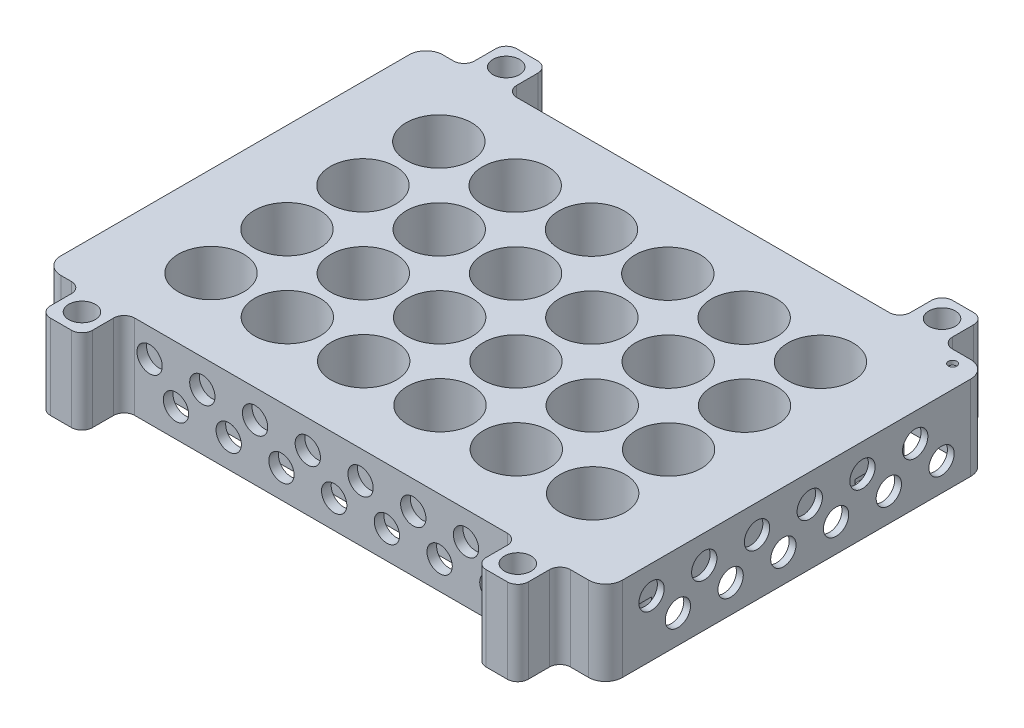
from build123d import *

# Parameters (mm, degrees)
SKETCH1_W           = 157.864
SKETCH1_H           = 90.551
BOSS_EXTRUDE1_DEPTH = 24.5
CUT_EXTRUDE30_DEPTH = 24.5
CUT_EXTRUDE5_START  = -24.5
SKETCH7_R           = 7.75
CUT_EXTRUDE5_DEPTH  = 17
SKETCH23_W          = 129.2861173
SKETCH23_H          = 86.72376579
SKETCH23_W_2        = 111.4861173
SKETCH23_H_2        = 74.72376579
CUT_EXTRUDE21_DEPTH = 4.5
FILLET7_R           = 1
FILLET8_R           = 2.75
SKETCH26_W          = 116.5861173
SKETCH26_H          = 74.72376579
CUT_EXTRUDE22_DEPTH = 3
SKETCH29_W          = 12.37533
SKETCH29_H          = 90.551
CUT_EXTRUDE25_DEPTH = 184.632176094
FILLET9_R           = 4
SKETCH30_W          = 10
SKETCH30_H          = 10
BOSS_EXTRUDE2_DEPTH = 24.5
SKETCH31_R          = 3.15
CUT_EXTRUDE26_DEPTH = 179.543290827
FILLET10_R          = 2.5
SKETCH35_R          = 1.4
BOSS_EXTRUDE3_DEPTH = 0.75
SKETCH37_W          = 236.034585018
SKETCH37_H          = 147.923412956
CUT_EXTRUDE29_DEPTH = 4.5
SKETCH36_W          = 129.28401949
SKETCH36_H          = 86.172693175
SKETCH36_W_2        = 111.787906872
SKETCH36_H_2        = 76.072830146
CUT_EXTRUDE28_DEPTH = 17
FILLET11_R          = 4
FILLET12_R          = 4
SKETCH42_R          = 3.1
CUT_EXTRUDE31_DEPTH = 2.75
SKETCH43_R          = 1
CUT_EXTRUDE32_DEPTH = 1
SKETCH44_R          = 3
CUT_EXTRUDE33_DEPTH = 2.220919758
SKETCH45_R          = 3
CUT_EXTRUDE34_DEPTH = 2.286228198
CUT_EXTRUDE35_START = -1.608400752
SKETCH46_R          = 3
CUT_EXTRUDE35_DEPTH = 1.608400752
SKETCH47_R          = 3
CUT_EXTRUDE36_DEPTH = 2.092078627


with BuildPart() as part:
    # Sketch1 → Boss-Extrude1 (new body)
    with BuildSketch(Plane(origin=(0, 0, 0), x_dir=(1, 0, 0), z_dir=(0, 1, 0))):
        with Locations((78.932, -45.2755)):
            Rectangle(SKETCH1_W, SKETCH1_H)
    extrude(amount=BOSS_EXTRUDE1_DEPTH)

    # Sketch39 → Cut-Extrude30 (cut)
    with BuildSketch(Plane(origin=(0, 24.5, 0), x_dir=(1, 0, 0), z_dir=(0, 1, 0))):
        Polygon((37.005804, -18.5555), (30.948984, -18.5555), (30.408196, -19.088448), (30.408196, -25.18537), (37.005804, -25.18537), align=None)
        Polygon((55.095804, -11.36563), (49.038984, -11.36563), (48.498196, -11.898578), (48.498196, -17.9955), (55.095804, -17.9955), align=None)
        Polygon((73.185804, -11.36563), (67.128984, -11.36563), (66.588196, -11.898578), (66.588196, -17.9955), (73.185804, -17.9955), align=None)
        Polygon((91.275804, -11.36563), (85.218984, -11.36563), (84.678196, -11.898578), (84.678196, -17.9955), (91.275804, -17.9955), align=None)
        Polygon((109.365804, -11.36563), (103.308984, -11.36563), (102.768196, -11.898578), (102.768196, -17.9955), (109.365804, -17.9955), align=None)
        Polygon((127.455804, -11.36563), (121.398984, -11.36563), (120.858196, -11.898578), (120.858196, -17.9955), (127.455804, -17.9955), align=None)
        Polygon((55.095804, -29.36563), (49.038984, -29.36563), (48.498196, -29.898578), (48.498196, -35.9955), (55.095804, -35.9955), align=None)
        Polygon((73.185804, -29.36563), (67.128984, -29.36563), (66.588196, -29.898578), (66.588196, -35.9955), (73.185804, -35.9955), align=None)
        Polygon((91.275804, -29.36563), (85.218984, -29.36563), (84.678196, -29.898578), (84.678196, -35.9955), (91.275804, -35.9955), align=None)
        Polygon((109.365804, -29.36563), (103.308984, -29.36563), (102.768196, -29.898578), (102.768196, -35.9955), (109.365804, -35.9955), align=None)
        Polygon((127.455804, -29.36563), (121.398984, -29.36563), (120.858196, -29.898578), (120.858196, -35.9955), (127.455804, -35.9955), align=None)
        Polygon((55.095804, -47.36563), (49.038984, -47.36563), (48.498196, -47.898578), (48.498196, -53.9955), (55.095804, -53.9955), align=None)
        Polygon((73.185804, -47.36563), (67.128984, -47.36563), (66.588196, -47.898578), (66.588196, -53.9955), (73.185804, -53.9955), align=None)
        Polygon((91.275804, -47.36563), (85.218984, -47.36563), (84.678196, -47.898578), (84.678196, -53.9955), (91.275804, -53.9955), align=None)
        Polygon((109.365804, -47.36563), (103.308984, -47.36563), (102.768196, -47.898578), (102.768196, -53.9955), (109.365804, -53.9955), align=None)
        Polygon((127.455804, -47.36563), (121.398984, -47.36563), (120.858196, -47.898578), (120.858196, -53.9955), (127.455804, -53.9955), align=None)
        Polygon((55.095804, -65.36563), (49.038984, -65.36563), (48.498196, -65.898578), (48.498196, -71.9955), (55.095804, -71.9955), align=None)
        Polygon((73.185804, -65.36563), (67.128984, -65.36563), (66.588196, -65.898578), (66.588196, -71.9955), (73.185804, -71.9955), align=None)
        Polygon((91.275804, -65.36563), (85.218984, -65.36563), (84.678196, -65.898578), (84.678196, -71.9955), (91.275804, -71.9955), align=None)
        Polygon((109.365804, -65.36563), (103.308984, -65.36563), (102.768196, -65.898578), (102.768196, -71.9955), (109.365804, -71.9955), align=None)
        Polygon((127.455804, -65.36563), (121.398984, -65.36563), (120.858196, -65.898578), (120.858196, -71.9955), (127.455804, -71.9955), align=None)
        Polygon((37.005804, -29.36563), (30.948984, -29.36563), (30.408196, -29.898578), (30.408196, -35.9955), (37.005804, -35.9955), align=None)
        Polygon((37.005804, -47.36563), (30.948984, -47.36563), (30.408196, -47.898578), (30.408196, -53.9955), (37.005804, -53.9955), align=None)
        Polygon((37.005804, -65.36563), (30.948984, -65.36563), (30.408196, -65.898578), (30.408196, -71.9955), (37.005804, -71.9955), align=None)
        Polygon((37.005804, -11.36563), (30.948984, -11.36563), (30.408196, -11.898578), (30.408196, -17.9955), (37.005804, -17.9955), align=None)
        Polygon((48.498196, -25.18537), (55.095804, -25.18537), (55.095804, -18.5555), (49.038984, -18.5555), (48.498196, -19.088448), align=None)
        Polygon((66.588196, -25.18537), (73.185804, -25.18537), (73.185804, -18.5555), (67.128984, -18.5555), (66.588196, -19.088448), align=None)
        Polygon((84.678196, -25.18537), (91.275804, -25.18537), (91.275804, -18.5555), (85.218984, -18.5555), (84.678196, -19.088448), align=None)
        Polygon((102.768196, -25.18537), (109.365804, -25.18537), (109.365804, -18.5555), (103.308984, -18.5555), (102.768196, -19.088448), align=None)
        Polygon((120.858196, -25.18537), (127.455804, -25.18537), (127.455804, -18.5555), (121.398984, -18.5555), (120.858196, -19.088448), align=None)
        Polygon((48.498196, -43.18537), (55.095804, -43.18537), (55.095804, -36.5555), (49.038984, -36.5555), (48.498196, -37.088448), align=None)
        Polygon((66.588196, -43.18537), (73.185804, -43.18537), (73.185804, -36.5555), (67.128984, -36.5555), (66.588196, -37.088448), align=None)
        Polygon((84.678196, -43.18537), (91.275804, -43.18537), (91.275804, -36.5555), (85.218984, -36.5555), (84.678196, -37.088448), align=None)
        Polygon((102.768196, -43.18537), (109.365804, -43.18537), (109.365804, -36.5555), (103.308984, -36.5555), (102.768196, -37.088448), align=None)
        Polygon((120.858196, -43.18537), (127.455804, -43.18537), (127.455804, -36.5555), (121.398984, -36.5555), (120.858196, -37.088448), align=None)
        Polygon((48.498196, -61.18537), (55.095804, -61.18537), (55.095804, -54.5555), (49.038984, -54.5555), (48.498196, -55.088448), align=None)
        Polygon((66.588196, -61.18537), (73.185804, -61.18537), (73.185804, -54.5555), (67.128984, -54.5555), (66.588196, -55.088448), align=None)
        Polygon((84.678196, -61.18537), (91.275804, -61.18537), (91.275804, -54.5555), (85.218984, -54.5555), (84.678196, -55.088448), align=None)
        Polygon((102.768196, -61.18537), (109.365804, -61.18537), (109.365804, -54.5555), (103.308984, -54.5555), (102.768196, -55.088448), align=None)
        Polygon((120.858196, -61.18537), (127.455804, -61.18537), (127.455804, -54.5555), (121.398984, -54.5555), (120.858196, -55.088448), align=None)
        Polygon((48.498196, -79.18537), (55.095804, -79.18537), (55.095804, -72.5555), (49.038984, -72.5555), (48.498196, -73.088448), align=None)
        Polygon((66.588196, -79.18537), (73.185804, -79.18537), (73.185804, -72.5555), (67.128984, -72.5555), (66.588196, -73.088448), align=None)
        Polygon((84.678196, -79.18537), (91.275804, -79.18537), (91.275804, -72.5555), (85.218984, -72.5555), (84.678196, -73.088448), align=None)
        Polygon((102.768196, -79.18537), (109.365804, -79.18537), (109.365804, -72.5555), (103.308984, -72.5555), (102.768196, -73.088448), align=None)
        Polygon((120.858196, -79.18537), (127.455804, -79.18537), (127.455804, -72.5555), (121.398984, -72.5555), (120.858196, -73.088448), align=None)
        Polygon((30.408196, -43.18537), (37.005804, -43.18537), (37.005804, -36.5555), (30.948984, -36.5555), (30.408196, -37.088448), align=None)
        Polygon((30.408196, -61.18537), (37.005804, -61.18537), (37.005804, -54.5555), (30.948984, -54.5555), (30.408196, -55.088448), align=None)
        Polygon((30.408196, -79.18537), (37.005804, -79.18537), (37.005804, -72.5555), (30.948984, -72.5555), (30.408196, -73.088448), align=None)
    extrude(amount=-CUT_EXTRUDE30_DEPTH, mode=Mode.SUBTRACT)

    # Sketch7 → Cut-Extrude5 (cut)
    with BuildSketch(Plane.XZ.offset(CUT_EXTRUDE5_START)):
        with Locations(Location((33.707, 72.2755, 0), (0, 0, 90))):
            Circle(SKETCH7_R)
        with Locations(Location((51.797, 72.2755, 0), (0, 0, 90))):
            Circle(SKETCH7_R)
        with Locations(Location((69.887, 72.2755, 0), (0, 0, 90))):
            Circle(SKETCH7_R)
        with Locations(Location((87.977, 72.2755, 0), (0, 0, 90))):
            Circle(SKETCH7_R)
        with Locations(Location((106.067, 72.2755, 0), (0, 0, 90))):
            Circle(SKETCH7_R)
        with Locations(Location((124.157, 72.2755, 0), (0, 0, 90))):
            Circle(SKETCH7_R)
        with Locations(Location((51.797, 54.2755, 0), (0, 0, 90))):
            Circle(SKETCH7_R)
        with Locations(Location((69.887, 54.2755, 0), (0, 0, 90))):
            Circle(SKETCH7_R)
        with Locations(Location((87.977, 54.2755, 0), (0, 0, 90))):
            Circle(SKETCH7_R)
        with Locations(Location((106.067, 54.2755, 0), (0, 0, 90))):
            Circle(SKETCH7_R)
        with Locations(Location((124.157, 54.2755, 0), (0, 0, 90))):
            Circle(SKETCH7_R)
        with Locations(Location((51.797, 36.2755, 0), (0, 0, 90))):
            Circle(SKETCH7_R)
        with Locations(Location((69.887, 36.2755, 0), (0, 0, 90))):
            Circle(SKETCH7_R)
        with Locations(Location((87.977, 36.2755, 0), (0, 0, 90))):
            Circle(SKETCH7_R)
        with Locations(Location((106.067, 36.2755, 0), (0, 0, 90))):
            Circle(SKETCH7_R)
        with Locations(Location((124.157, 36.2755, 0), (0, 0, 90))):
            Circle(SKETCH7_R)
        with Locations(Location((51.797, 18.2755, 0), (0, 0, 90))):
            Circle(SKETCH7_R)
        with Locations(Location((69.887, 18.2755, 0), (0, 0, 90))):
            Circle(SKETCH7_R)
        with Locations(Location((87.977, 18.2755, 0), (0, 0, 90))):
            Circle(SKETCH7_R)
        with Locations(Location((106.067, 18.2755, 0), (0, 0, 90))):
            Circle(SKETCH7_R)
        with Locations(Location((124.157, 18.2755, 0), (0, 0, 90))):
            Circle(SKETCH7_R)
        with Locations(Location((33.707, 54.2755, 0), (0, 0, 90))):
            Circle(SKETCH7_R)
        with Locations(Location((33.707, 36.2755, 0), (0, 0, 90))):
            Circle(SKETCH7_R)
        with Locations(Location((33.707, 18.2755, 0), (0, 0, 90))):
            Circle(SKETCH7_R)
    extrude(amount=CUT_EXTRUDE5_DEPTH, mode=Mode.SUBTRACT)

    # Sketch23 → Cut-Extrude21 (cut)
    with BuildSketch(Plane(origin=(0, 24.5, 0), x_dir=(1, 0, 0), z_dir=(0, 1, 0))):
        with Locations((78.93200135, -45.275497105)):
            Rectangle(SKETCH23_W, SKETCH23_H)
        with Locations((78.93200135, -45.275497105)):
            Rectangle(SKETCH23_W_2, SKETCH23_H_2, mode=Mode.SUBTRACT)
    extrude(amount=-CUT_EXTRUDE21_DEPTH, mode=Mode.SUBTRACT)

    # Fillet7
    fillet7_edges = [part.edges().sort_by_distance(p)[0] for p in [
        (134.67506, 22.25, 82.63738),
        (23.1889427, 22.25, 82.63738),
        (23.1889427, 22.25, 7.91361421),
        (134.67506, 22.25, 7.91361421),
    ]]
    fillet(fillet7_edges, radius=FILLET7_R)

    # Fillet8
    fillet8_edges = [part.edges().sort_by_distance(p)[0] for p in [
        (143.57506, 22.25, 1.91361421),
        (143.57506, 22.25, 88.63738),
        (14.2889427, 22.25, 88.63738),
        (14.2889427, 22.25, 1.91361421),
    ]]
    fillet(fillet8_edges, radius=FILLET8_R)

    # Sketch26 → Cut-Extrude22 (cut)
    with BuildSketch(Plane(origin=(0, 24.5, 0), x_dir=(1, 0, 0), z_dir=(0, 1, 0))):
        with Locations((76.38200135, -45.275497105)):
            Rectangle(SKETCH26_W, SKETCH26_H)
    extrude(amount=-CUT_EXTRUDE22_DEPTH, mode=Mode.SUBTRACT)

    # Sketch29 → Cut-Extrude25 (cut, through all)
    with BuildSketch(Plane(origin=(0, 24.5, 0), x_dir=(1, 0, 0), z_dir=(0, 1, 0))):
        with Locations((151.676335, -45.2755)):
            Rectangle(SKETCH29_W, SKETCH29_H)
        with Locations((6.187665, -45.2755)):
            Rectangle(SKETCH29_W, SKETCH29_H)
    extrude(amount=-CUT_EXTRUDE25_DEPTH, mode=Mode.SUBTRACT)

    # Fillet9
    fillet9_edges = [part.edges().sort_by_distance(p)[0] for p in [
        (145.48867, 12.25, 90.551),
        (145.48867, 12.25, 0),
        (12.37533, 12.25, 0),
        (12.37533, 12.25, 90.551),
    ]]
    fillet(fillet9_edges, radius=FILLET9_R)

    # Sketch30 → Boss-Extrude2 (add, through all)
    with BuildSketch(Plane.XZ):
        with Locations((129.6936, -5)):
            Rectangle(SKETCH30_W, SKETCH30_H)
        with Locations((26.3936, -5)):
            Rectangle(SKETCH30_W, SKETCH30_H)
        with Locations((129.6936, 95.551)):
            Rectangle(SKETCH30_W, SKETCH30_H)
        with Locations((26.3936, 95.551)):
            Rectangle(SKETCH30_W, SKETCH30_H)
    extrude(amount=-BOSS_EXTRUDE2_DEPTH)

    # Sketch31 → Cut-Extrude26 (cut, through all)
    with BuildSketch(Plane(origin=(0, 24.5, 0), x_dir=(1, 0, 0), z_dir=(0, 1, 0))):
        with Locations(Location((26.3936, 5, 0), (0, 0, 270))):
            Circle(SKETCH31_R)
        with Locations(Location((129.6936, 5, 0), (0, 0, 270))):
            Circle(SKETCH31_R)
        with Locations(Location((26.3936, -95.551, 0), (0, 0, 270))):
            Circle(SKETCH31_R)
        with Locations(Location((129.6936, -95.551, 0), (0, 0, 270))):
            Circle(SKETCH31_R)
    extrude(amount=-CUT_EXTRUDE26_DEPTH, mode=Mode.SUBTRACT)

    # Fillet10
    fillet10_edges = [part.edges().sort_by_distance(p)[0] for p in [
        (134.6936, 12.25, 0),
        (134.6936, 12.25, -10),
        (124.6936, 12.25, -10),
        (124.6936, 12.25, 0),
        (21.3936, 12.25, -10),
        (21.3936, 12.25, 0),
        (31.3936, 12.25, 0),
        (31.3936, 12.25, -10),
        (134.6936, 12.25, 100.551),
        (134.6936, 12.25, 90.551),
        (124.6936, 12.25, 90.551),
        (124.6936, 12.25, 100.551),
        (21.3936, 12.25, 90.551),
        (21.3936, 12.25, 100.551),
        (31.3936, 12.25, 100.551),
        (31.3936, 12.25, 90.551),
    ]]
    fillet(fillet10_edges, radius=FILLET10_R)

    # Sketch35 → Boss-Extrude3 (add)
    with BuildSketch(Plane(origin=(0, 21.5, 0), x_dir=(1, 0, 0), z_dir=(0, 1, 0))):
        with Locations(Location((115.112, -27.2755, 0), (0, 0, 90))):
            Circle(SKETCH35_R)
        with Locations(Location((42.752, -63.2755, 0), (0, 0, 90))):
            Circle(SKETCH35_R)
    extrude(amount=BOSS_EXTRUDE3_DEPTH)

    # Sketch37 → Cut-Extrude29 (cut)
    with BuildSketch(Plane(origin=(0, 24.5, 0), x_dir=(1, 0, 0), z_dir=(0, 1, 0))):
        with Locations((96.643531952, -44.613547987)):
            Rectangle(SKETCH37_W, SKETCH37_H)
    extrude(amount=-CUT_EXTRUDE29_DEPTH, mode=Mode.SUBTRACT)

    # Sketch36 → Cut-Extrude28 (cut)
    with BuildSketch(Plane.XZ):
        with Locations((79.238259503, 45.178425215)):
            Rectangle(SKETCH36_W, SKETCH36_H)
        with Locations((79.238259503, 45.178425215)):
            Rectangle(SKETCH36_W_2, SKETCH36_H_2, mode=Mode.SUBTRACT)
    extrude(amount=-CUT_EXTRUDE28_DEPTH, mode=Mode.SUBTRACT)

    # Fillet11
    fillet11_edges = [part.edges().sort_by_distance(p)[0] for p in [
        (23.344306067, 8.5, 83.214840288),
        (135.132212939, 8.5, 83.214840288),
        (135.132212939, 8.5, 7.142010142),
        (23.344306067, 8.5, 7.142010142),
    ]]
    fillet(fillet11_edges, radius=FILLET11_R)

    # Fillet12
    fillet12_edges = [part.edges().sort_by_distance(p)[0] for p in [
        (14.596249758, 8.5, 2.092078627),
        (14.596249758, 8.5, 88.264771802),
        (143.880269248, 8.5, 88.264771802),
        (143.880269248, 8.5, 2.092078627),
    ]]
    fillet(fillet12_edges, radius=FILLET12_R)

    # Sketch42 → Cut-Extrude31 (cut)
    with BuildSketch(Plane.XZ):
        with Locations((22.183259503, 72.173425215)):
            Circle(SKETCH42_R)
        with Locations((22.183259503, 18.183425215)):
            Circle(SKETCH42_R)
        with Locations((136.293259503, 18.183425215)):
            Circle(SKETCH42_R)
        with Locations((136.293259503, 72.173425215)):
            Circle(SKETCH42_R)
    extrude(amount=-CUT_EXTRUDE31_DEPTH, mode=Mode.SUBTRACT)

    # Sketch43 → Cut-Extrude32 (cut)
    with BuildSketch(Plane(origin=(0, 20, 0), x_dir=(1, 0, 0), z_dir=(0, 1, 0))):
        with Locations(Location((140.1936, -3, 0), (0, 0, 270))):
            Circle(SKETCH43_R)
    extrude(amount=-CUT_EXTRUDE32_DEPTH, mode=Mode.SUBTRACT)

    # Sketch44 → Cut-Extrude33 (cut)
    with BuildSketch(Plane.ZY.offset(-12.37533)):
        with Locations((10.9005, 6.666666667)):
            Circle(SKETCH44_R)
        with Locations((23.4005, 6.666666667)):
            Circle(SKETCH44_R)
        with Locations((35.9005, 6.666666667)):
            Circle(SKETCH44_R)
        with Locations((48.4005, 6.666666667)):
            Circle(SKETCH44_R)
        with Locations((60.9005, 6.666666667)):
            Circle(SKETCH44_R)
        with Locations((73.4005, 6.666666667)):
            Circle(SKETCH44_R)
        with Locations((17.1505, 13.333333333)):
            Circle(SKETCH44_R)
        with Locations((29.6505, 13.333333333)):
            Circle(SKETCH44_R)
        with Locations((42.1505, 13.333333333)):
            Circle(SKETCH44_R)
        with Locations((54.6505, 13.333333333)):
            Circle(SKETCH44_R)
        with Locations((67.1505, 13.333333333)):
            Circle(SKETCH44_R)
        with Locations((79.6505, 13.333333333)):
            Circle(SKETCH44_R)
    extrude(amount=-CUT_EXTRUDE33_DEPTH, mode=Mode.SUBTRACT)

    # Sketch45 → Cut-Extrude34 (cut)
    with BuildSketch(Plane.XY.offset(90.551)):
        with Locations((37.4186, 13.333333333)):
            Circle(SKETCH45_R)
        with Locations((49.9186, 13.333333333)):
            Circle(SKETCH45_R)
        with Locations((62.4186, 13.333333333)):
            Circle(SKETCH45_R)
        with Locations((74.9186, 13.333333333)):
            Circle(SKETCH45_R)
        with Locations((87.4186, 13.333333333)):
            Circle(SKETCH45_R)
        with Locations((99.9186, 13.333333333)):
            Circle(SKETCH45_R)
        with Locations((112.4186, 13.333333333)):
            Circle(SKETCH45_R)
        with Locations((43.6686, 6.666666667)):
            Circle(SKETCH45_R)
        with Locations((56.1686, 6.666666667)):
            Circle(SKETCH45_R)
        with Locations((68.6686, 6.666666667)):
            Circle(SKETCH45_R)
        with Locations((81.1686, 6.666666667)):
            Circle(SKETCH45_R)
        with Locations((93.6686, 6.666666667)):
            Circle(SKETCH45_R)
        with Locations((106.1686, 6.666666667)):
            Circle(SKETCH45_R)
        with Locations((118.6686, 6.666666667)):
            Circle(SKETCH45_R)
    extrude(amount=-CUT_EXTRUDE34_DEPTH, mode=Mode.SUBTRACT)

    # Sketch46 → Cut-Extrude35 (cut)
    with BuildSketch(Plane(origin=(145.48867, 0, 0), x_dir=(0, 0, -1), z_dir=(1, 0, 0)).offset(CUT_EXTRUDE35_START)):
        with Locations(Location((-79.6505, 13.333333333, 0), (0, 0, 180))):
            Circle(SKETCH46_R)
        with Locations(Location((-67.1505, 13.333333333, 0), (0, 0, 180))):
            Circle(SKETCH46_R)
        with Locations(Location((-54.6505, 13.333333333, 0), (0, 0, 180))):
            Circle(SKETCH46_R)
        with Locations(Location((-42.1505, 13.333333333, 0), (0, 0, 180))):
            Circle(SKETCH46_R)
        with Locations(Location((-29.6505, 13.333333333, 0), (0, 0, 180))):
            Circle(SKETCH46_R)
        with Locations(Location((-73.4005, 6.666666667, 0), (0, 0, 180))):
            Circle(SKETCH46_R)
        with Locations(Location((-17.1505, 13.333333333, 0), (0, 0, 180))):
            Circle(SKETCH46_R)
        with Locations(Location((-60.9005, 6.666666667, 0), (0, 0, 180))):
            Circle(SKETCH46_R)
        with Locations(Location((-48.4005, 6.666666667, 0), (0, 0, 180))):
            Circle(SKETCH46_R)
        with Locations(Location((-35.9005, 6.666666667, 0), (0, 0, 180))):
            Circle(SKETCH46_R)
        with Locations(Location((-23.4005, 6.666666667, 0), (0, 0, 180))):
            Circle(SKETCH46_R)
        with Locations(Location((-10.9005, 6.666666667, 0), (0, 0, 180))):
            Circle(SKETCH46_R)
    extrude(amount=CUT_EXTRUDE35_DEPTH, mode=Mode.SUBTRACT)

    # Sketch47 → Cut-Extrude36 (cut)
    with BuildSketch(Plane(origin=(0, 0, 0), x_dir=(-1, 0, 0), z_dir=(0, 0, -1))):
        with Locations((-118.6686, 13.333333333)):
            Circle(SKETCH47_R)
        with Locations((-43.6686, 13.333333333)):
            Circle(SKETCH47_R)
        with Locations((-81.1686, 13.333333333)):
            Circle(SKETCH47_R)
        with Locations((-68.6686, 13.333333333)):
            Circle(SKETCH47_R)
        with Locations((-56.1686, 13.333333333)):
            Circle(SKETCH47_R)
        with Locations((-93.6686, 13.333333333)):
            Circle(SKETCH47_R)
        with Locations((-106.1686, 13.333333333)):
            Circle(SKETCH47_R)
        with Locations((-112.4186, 6.666666667)):
            Circle(SKETCH47_R)
        with Locations((-99.9186, 6.666666667)):
            Circle(SKETCH47_R)
        with Locations((-87.4186, 6.666666667)):
            Circle(SKETCH47_R)
        with Locations((-74.9186, 6.666666667)):
            Circle(SKETCH47_R)
        with Locations((-62.4186, 6.666666667)):
            Circle(SKETCH47_R)
        with Locations((-49.9186, 6.666666667)):
            Circle(SKETCH47_R)
        with Locations((-37.4186, 6.666666667)):
            Circle(SKETCH47_R)
    extrude(amount=-CUT_EXTRUDE36_DEPTH, mode=Mode.SUBTRACT)


solid = part.part
